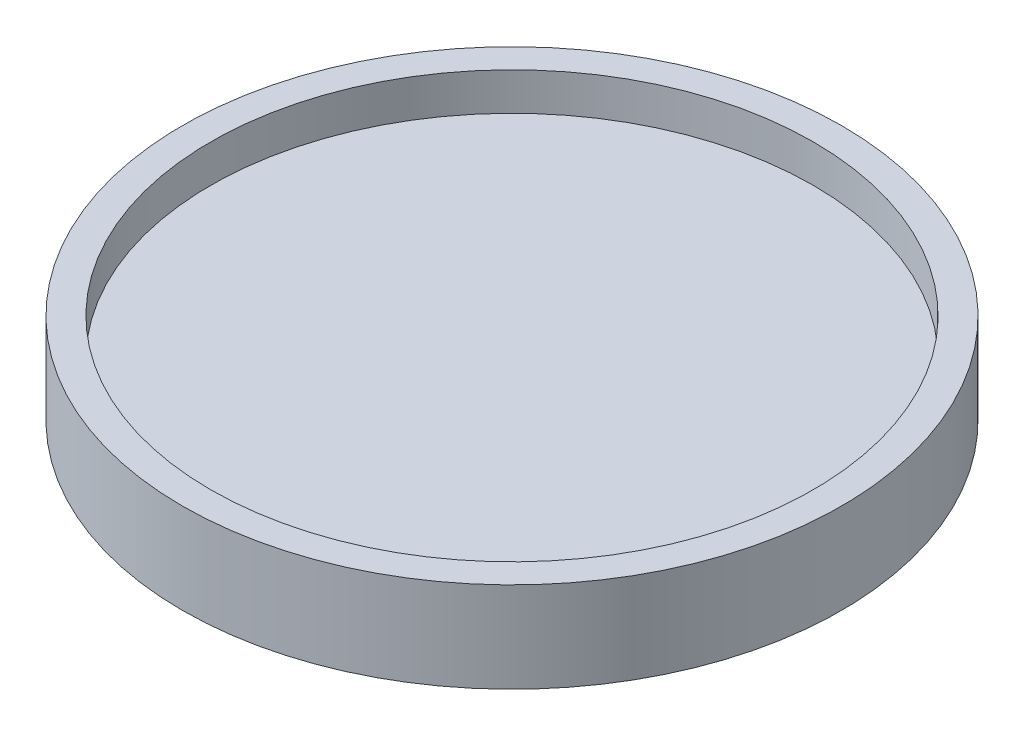
from build123d import *

# Parameters (mm, degrees)
SKETCH2_R           = 11.1125
BOSS_EXTRUDE1_DEPTH = 3.048
SKETCH3_R           = 10.16
CUT_EXTRUDE1_DEPTH  = 1.27
SKETCH4_R           = 3.81
CUT_EXTRUDE2_DEPTH  = 1.27
FILLET1_R           = 15.08


with BuildPart() as part:
    # Sketch2 → Boss-Extrude1 (new body)
    with BuildSketch(Plane(origin=(0, 0, 0), x_dir=(1, 0, 0), z_dir=(0, 1, 0))):
        with Locations(Location((0, 0, 0), (0, 0, 90))):
            Circle(SKETCH2_R)
    extrude(amount=BOSS_EXTRUDE1_DEPTH)

    # Sketch3 → Cut-Extrude1 (cut)
    with BuildSketch(Plane(origin=(0, 3.048, 0), x_dir=(1, 0, 0), z_dir=(0, 1, 0))):
        with Locations(Location((0, 0, 0), (0, 0, 270))):
            Circle(SKETCH3_R)
    extrude(amount=-CUT_EXTRUDE1_DEPTH, mode=Mode.SUBTRACT)

    # Sketch4 → Cut-Extrude2 (cut)
    with BuildSketch(Plane(origin=(0, 0, 0), x_dir=(-1, 0, 0), z_dir=(0, -1, 0))):
        with Locations(Location((0, 0, 0), (0, 0, 90))):
            Circle(SKETCH4_R)
    extrude(amount=-CUT_EXTRUDE2_DEPTH, mode=Mode.SUBTRACT)

    # Fillet1
    # the kernel refuses this fillet: 15.08 mm, written as the material it takes off along each edge
    with BuildSketch(Plane(origin=(0, 0, 0), x_dir=(0, 0, -1), z_dir=(-1, 0, 0))) as fillet1_piece_1:
        with BuildLine():
            CenterArc((9.867251852, -15.08), FILLET1_R, 90, 23.682902999)
            Line((3.81, -1.27), (3.81, 0))
            Line((3.81, 0), (9.867251852, 0))
        make_face()
    revolve(axis=Axis((0, 0, 0), (0, -1, 0)), mode=Mode.SUBTRACT)


solid = part.part
